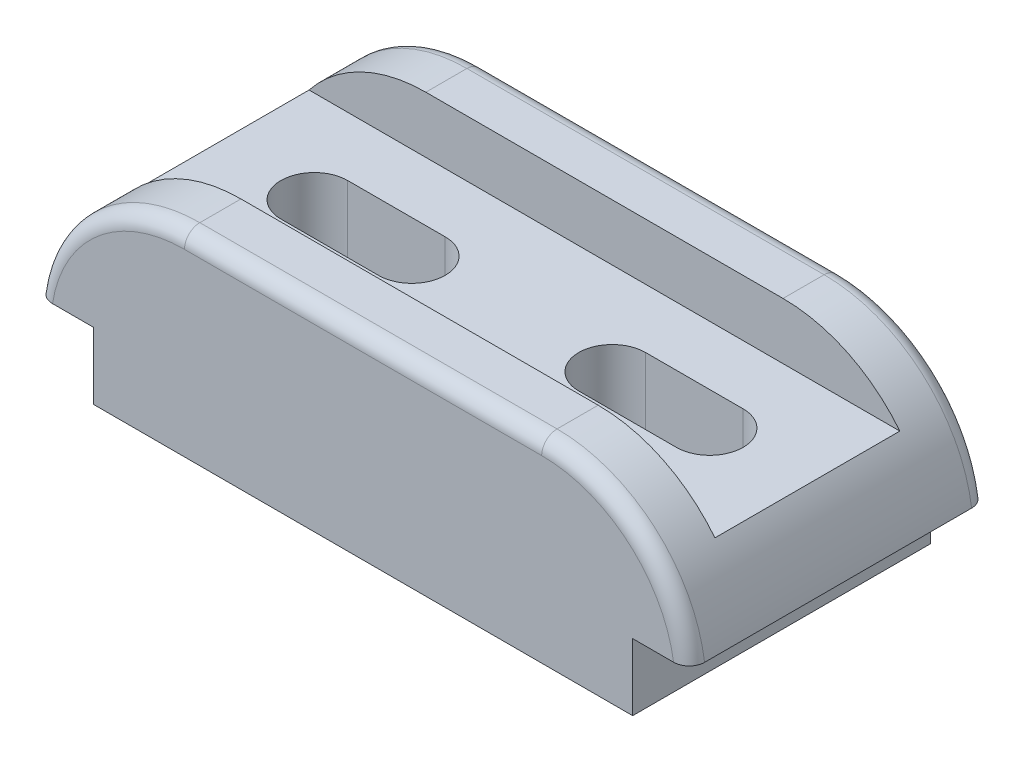
from build123d import *

# Parameters (mm, degrees)
ESQUISSE1_W             = 127
ESQUISSE1_H             = 38
BASE_EXTRUSION_DEPTH    = 29
ESQUISSE2_W             = 11
ESQUISSE2_H             = 13
ENL_V_MAT_EXTRU_1_DEPTH = 95.022603665
CONG_1_R                = 29
ESQUISSE3_W             = 127
ESQUISSE3_H             = 36
ENL_V_MAT_EXTRU_2_DEPTH = 11
ENL_V_MAT_EXTRU_3_DEPTH = 75.848179671
CONG_2_R                = 3


with BuildPart() as part:
    # Esquisse1 → Base-Extrusion (new, symmetric)
    with BuildSketch(Plane.XY):
        with Locations((0, 19)):
            Rectangle(ESQUISSE1_W, ESQUISSE1_H)
    extrude(amount=BASE_EXTRUSION_DEPTH, both=True)

    # Esquisse2 → Enlèv. mat.-Extru.1 (cut, through all)
    with BuildSketch(Plane.XY.offset(29)):
        with Locations((-58, 6.5)):
            Rectangle(ESQUISSE2_W, ESQUISSE2_H)
        with Locations((58, 6.5)):
            Rectangle(ESQUISSE2_W, ESQUISSE2_H)
    extrude(amount=-ENL_V_MAT_EXTRU_1_DEPTH, mode=Mode.SUBTRACT)

    # Congé1
    # the kernel refuses this fillet: 29 mm, written as the material it takes off along each edge
    with BuildSketch(Plane(origin=(-63.5, 38, 100.807033082), x_dir=(0, -1, 0), z_dir=(0, 0, -1))) as cong_1_piece_1:
        with BuildLine():
            CenterArc((29, -28.722813233), CONG_1_R, 97.928141766, 82.071858234)
            Line((0, -28.722813233), (-0.58, -28.722813233))
            Line((-0.58, -28.722813233), (-0.58, 0))
            Line((-0.58, 0), (0, 0.58))
            ThreePointArc((0, 0.58), (12.5, 0.58), (24.92, 0.574456265))
            Line((24.92, 0.574456265), (25, 0))
        make_face()
    extrude(amount=201.614066163, mode=Mode.SUBTRACT)
    with BuildSketch(Plane(origin=(63.5, 38, -100.807033082), x_dir=(-1, 0, 0), z_dir=(0, 0, 1))) as cong_1_piece_2:
        with BuildLine():
            CenterArc((28.722813233, 29), CONG_1_R, 187.928141766, 82.071858234)
            Line((0, 25), (-0.574456265, 24.92))
            ThreePointArc((-0.574456265, 24.92), (-0.58, 12.5), (-0.58, 0))
            Line((-0.58, 0), (0, -0.58))
            Line((0, -0.58), (28.722813233, -0.58))
            Line((28.722813233, -0.58), (28.722813233, 0))
        make_face()
    extrude(amount=201.614066163, mode=Mode.SUBTRACT)

    # Esquisse3 → Enlèv. mat.-Extru.2 (cut)
    with BuildSketch(Plane(origin=(0, 38, 0), x_dir=(-1, 0, 0), z_dir=(0, 1, 0))):
        Rectangle(ESQUISSE3_W, ESQUISSE3_H)
    extrude(amount=-ENL_V_MAT_EXTRU_2_DEPTH, mode=Mode.SUBTRACT)

    # Esquisse4 → Enlèv. mat.-Extru.3 (cut, through all)
    with BuildSketch(Plane(origin=(0, 27, 0), x_dir=(-1, 0, 0), z_dir=(0, 1, 0))):
        with BuildLine():
            Line((19.5, -6.5), (38.5, -6.5))
            ThreePointArc((38.5, -6.5), (45, 0), (38.5, 6.5))
            Line((38.5, 6.5), (19.5, 6.5))
            ThreePointArc((19.5, 6.5), (13, 0), (19.5, -6.5))
        make_face()
    enl_v_mat_extru_3 = extrude(amount=-ENL_V_MAT_EXTRU_3_DEPTH, mode=Mode.SUBTRACT)

    # Symétrie1: Enlèv. mat.-Extru.3 across plane
    add(enl_v_mat_extru_3.mirror(Plane(origin=(0, 0, 0), x_dir=(0, 0, 1), z_dir=(1, 0, 0))), mode=Mode.SUBTRACT)

    # Congé2
    cong_2_edges = [part.edges().sort_by_distance(p)[0] for p in [
        (0, 38, -29),
        (53.816619532, 30.874642854, -29),
        (-53.816619532, 30.874642854, -29),
        (0, 38, 29),
        (53.816619532, 30.874642854, 29),
        (-53.816619532, 30.874642854, 29),
    ]]
    fillet(cong_2_edges, radius=CONG_2_R)


solid = part.part
